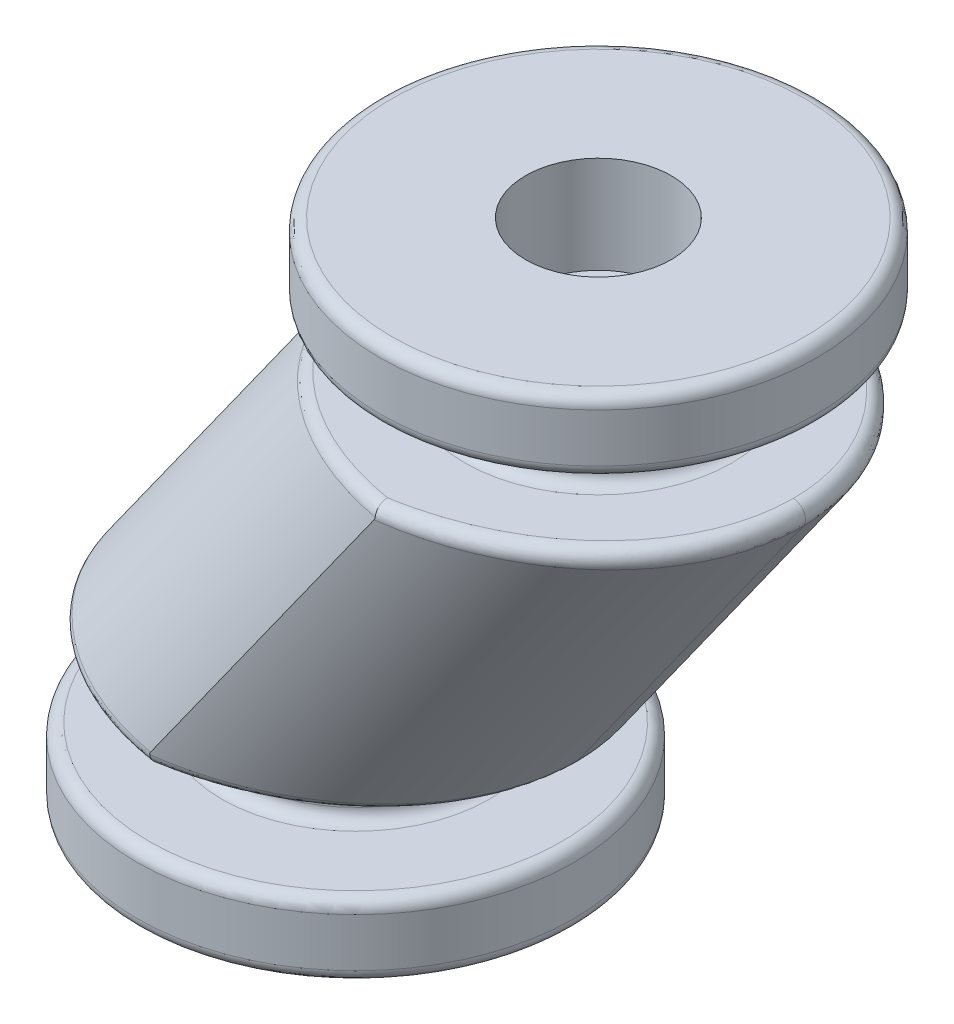
from build123d import *

# Parameters (mm, degrees)
BOSS_EXTRUDE2_DEPTH = 9
FILLET1_R           = 4.5
SKETCH2_R           = 2.5
BOSS_EXTRUDE3_DEPTH = 1.5
SKETCH3_R           = 4.5
BOSS_EXTRUDE4_DEPTH = 1.5
SKETCH4_R           = 2.5
BOSS_EXTRUDE5_DEPTH = 1.5
SKETCH5_R           = 4.5
BOSS_EXTRUDE6_DEPTH = 1.5
FILLET2_R           = 0.25
SKETCH6_R           = 1.5
CUT_EXTRUDE1_DEPTH  = 2
SKETCH7_R           = 1.5
CUT_EXTRUDE2_DEPTH  = 2


with BuildPart() as part:
    # Sketch1 → Boss-Extrude2 (new body)
    with BuildSketch(Plane.XY):
        Polygon((-4.5, -3.5), (4.5, -3.5), (9.5, 3.5), (0.5, 3.5), align=None)
    extrude(amount=BOSS_EXTRUDE2_DEPTH)

    # Fillet1
    # the kernel refuses this fillet: 4.5 mm, written as the material it takes off along each edge
    with BuildSketch(Plane(origin=(-2.038929679, -12.654501551, 9), x_dir=(0, 0, -1), z_dir=(0.5812381937190966, 0.8137334712067349, 0)), Plane(origin=(7.038929679, 12.654501551, 9), x_dir=(0, 0, -1), z_dir=(-0.5812381937190966, -0.8137334712067349, 0))) as fillet1_piece_1:
        with BuildLine():
            CenterArc((FILLET1_R, FILLET1_R), FILLET1_R, 180, 90)
            Line((0, FILLET1_R), (0, 0))
            Line((0, 0), (FILLET1_R, 0))
        make_face()
    extrude(amount=31.102325267, mode=Mode.SUBTRACT)
    with BuildSketch(Plane(origin=(7.038929679, 12.654501551, 0), x_dir=(0, 0, 1), z_dir=(-0.5812381937190966, -0.8137334712067349, 0)), Plane(origin=(-2.038929679, -12.654501551, 0), x_dir=(0, 0, 1), z_dir=(0.5812381937190966, 0.8137334712067349, 0))) as fillet1_piece_2:
        with BuildLine():
            CenterArc((FILLET1_R, -FILLET1_R), FILLET1_R, 90, 90)
            Line((0, -FILLET1_R), (0, 0))
            Line((0, 0), (FILLET1_R, 0))
        make_face()
    extrude(amount=31.102325267, mode=Mode.SUBTRACT)

    # Sketch2 → Boss-Extrude3 (add)
    with BuildSketch(Plane(origin=(0, 3.5, 0), x_dir=(1, 0, 0), z_dir=(0, 1, 0))):
        with Locations(Location((5, -4.5, 0), (0, 0, 90))):
            Circle(SKETCH2_R)
    extrude(amount=BOSS_EXTRUDE3_DEPTH)

    # Sketch3 → Boss-Extrude4 (add)
    with BuildSketch(Plane(origin=(0, 5, 0), x_dir=(1, 0, 0), z_dir=(0, 1, 0))):
        with Locations(Location((5, -4.5, 0), (0, 0, 270))):
            Circle(SKETCH3_R)
    extrude(amount=BOSS_EXTRUDE4_DEPTH)

    # Sketch4 → Boss-Extrude5 (add)
    with BuildSketch(Plane(origin=(0, -3.5, 0), x_dir=(-1, 0, 0), z_dir=(0, -1, 0))):
        with Locations(Location((0, -4.5, 0), (0, 0, 270))):
            Circle(SKETCH4_R)
    extrude(amount=BOSS_EXTRUDE5_DEPTH)

    # Sketch5 → Boss-Extrude6 (add)
    with BuildSketch(Plane(origin=(0, -5, 0), x_dir=(-1, 0, 0), z_dir=(0, -1, 0))):
        with Locations(Location((0, -4.5, 0), (0, 0, 90))):
            Circle(SKETCH5_R)
    extrude(amount=BOSS_EXTRUDE6_DEPTH)

    # Fillet2
    fillet2_edges = [part.edges().sort_by_distance(p)[0] for p in [
        (8.07765689, 3.5, 1.487180717),
        (1.92234311, 3.5, 1.487180717),
        (1.92234311, 3.5, 7.512819283),
        (8.07765689, 3.5, 7.512819283),
        (3.07765689, -3.5, 1.487180717),
        (-3.07765689, -3.5, 1.487180717),
        (-3.07765689, -3.5, 7.512819283),
        (3.07765689, -3.5, 7.512819283),
        (5, 3.5, 7),
        (5, 5, 7),
        (5, 5, 0),
        (5, 6.5, 0),
        (0, -3.5, 2),
        (0, -5, 2),
        (0, -5, 9),
        (0, -6.5, 9),
    ]]
    fillet(fillet2_edges, radius=FILLET2_R)

    # Sketch6 → Cut-Extrude1 (cut)
    with BuildSketch(Plane(origin=(0, 6.5, 0), x_dir=(1, 0, 0), z_dir=(0, 1, 0))):
        with Locations(Location((5, -4.5, 0), (0, 0, 270))):
            Circle(SKETCH6_R)
    extrude(amount=-CUT_EXTRUDE1_DEPTH, mode=Mode.SUBTRACT)

    # Sketch7 → Cut-Extrude2 (cut)
    with BuildSketch(Plane(origin=(0, -6.5, 0), x_dir=(-1, 0, 0), z_dir=(0, -1, 0))):
        with Locations(Location((0, -4.5, 0), (0, 0, 90))):
            Circle(SKETCH7_R)
    extrude(amount=-CUT_EXTRUDE2_DEPTH, mode=Mode.SUBTRACT)


solid = part.part
